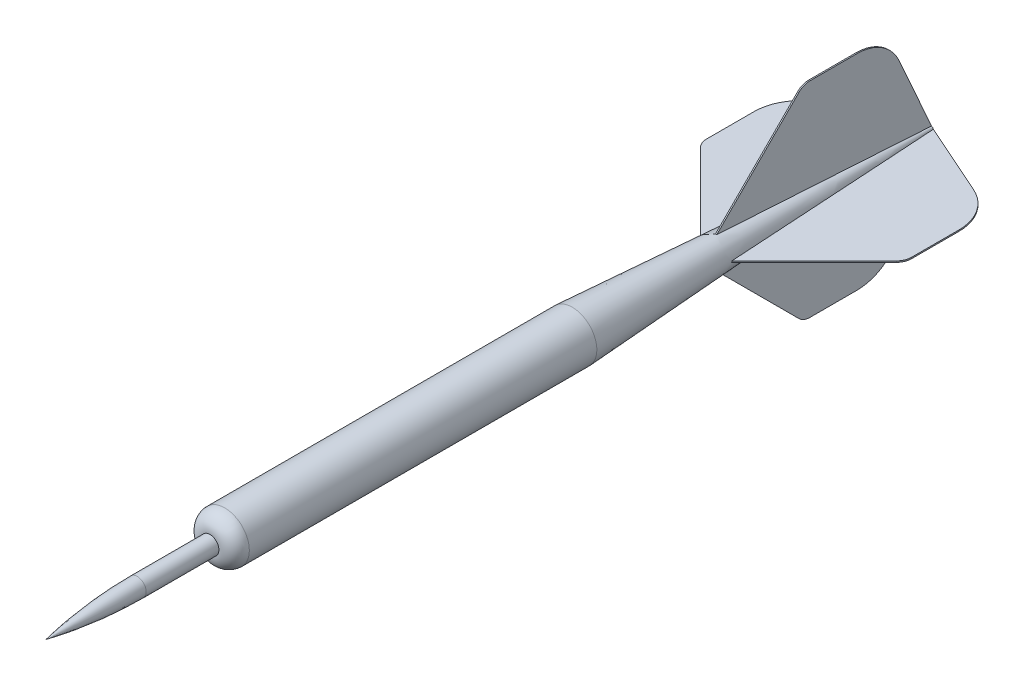
from build123d import *

# Parameters (mm, degrees)
FLIGHT_DEPTH  = 0.125
FLIGHTS_COUNT = 4


with BuildPart() as part:
    # Sketch1 → Dart (revolve)
    with BuildSketch(Plane(origin=(0, 0, 0), x_dir=(0, 0, -1), z_dir=(1, 0, 0))):
        with BuildLine():
            Line((0, 0), (-32, 0))
            ThreePointArc((-32, 0), (-23.1376223, 1.311449123), (-14.189476658, 1.75))
            Line((-14.189476658, 1.75), (0, 1.75))
            ThreePointArc((0, 1.75), (0.787661698, 3.896312185), (2.887760572, 4.8))
            Line((2.887760572, 4.8), (70.72, 4.8))
            Line((70.72, 4.8), (140.72, 0.5))
            Line((140.72, 0.5), (140.72, 0))
            Line((140.72, 0), (0, 0))
        make_face()
    revolve(axis=Axis((0, 0, -140.72), (0, 0, 1)))

    # Sketch3 → Flight (add, symmetric)
    with BuildSketch(Plane(origin=(0, 0, 0), x_dir=(0, 0, -1), z_dir=(1, 0, 0))):
        with BuildLine():
            Line((95.72, 0), (114.841320344, 19.121320344))
            ThreePointArc((114.841320344, 19.121320344), (115.81459039, 19.771638598), (116.962640687, 20))
            Line((116.962640687, 20), (126.193372298, 20))
            ThreePointArc((126.193372298, 20), (131.095123613, 18.548035112), (134.415281416, 14.660629788))
            Line((134.415281416, 14.660629788), (140.72, 0.5))
            Line((140.72, 0.5), (140.72, 0))
            Line((140.72, 0), (95.72, 0))
        make_face()
    flight = extrude(amount=FLIGHT_DEPTH, both=True)

    # Flights: Flight ×4 about axis
    flights_axis = Axis((0, 0, -140.72), (0, 0, -1))
    for i in range(1, FLIGHTS_COUNT):
        add(flight.rotate(flights_axis, i * 360 / FLIGHTS_COUNT))


solid = part.part
